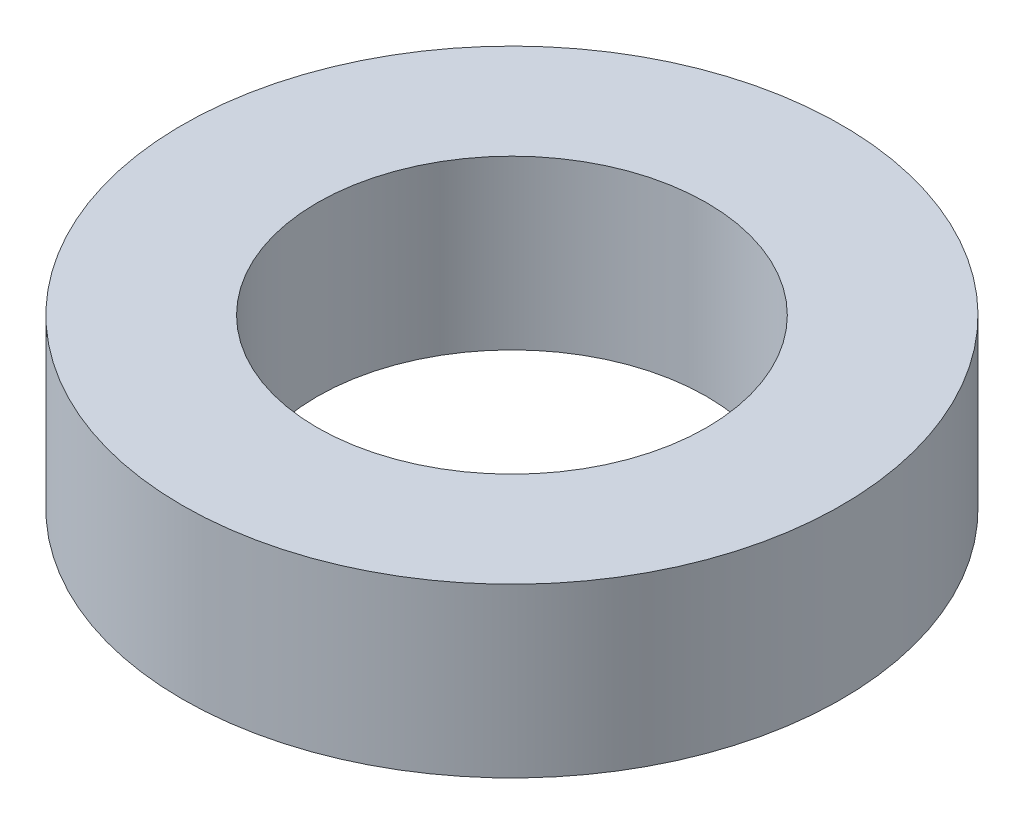
from build123d import *

# Parameters (mm, degrees)
SKETCH1_R           = 55
BOSS_EXTRUDE1_DEPTH = 28
SKETCH2_R           = 32.5
CUT_EXTRUDE1_DEPTH  = 83.668010742


with BuildPart() as part:
    # Sketch1 → Boss-Extrude1 (new body)
    with BuildSketch(Plane(origin=(0, 0, 0), x_dir=(1, 0, 0), z_dir=(0, 1, 0))):
        Circle(SKETCH1_R)
    extrude(amount=BOSS_EXTRUDE1_DEPTH)

    # Sketch2 → Cut-Extrude1 (cut, through all)
    with BuildSketch(Plane(origin=(0, 0, 0), x_dir=(1, 0, 0), z_dir=(0, 1, 0))):
        Circle(SKETCH2_R)
    extrude(amount=CUT_EXTRUDE1_DEPTH, mode=Mode.SUBTRACT)


solid = part.part
